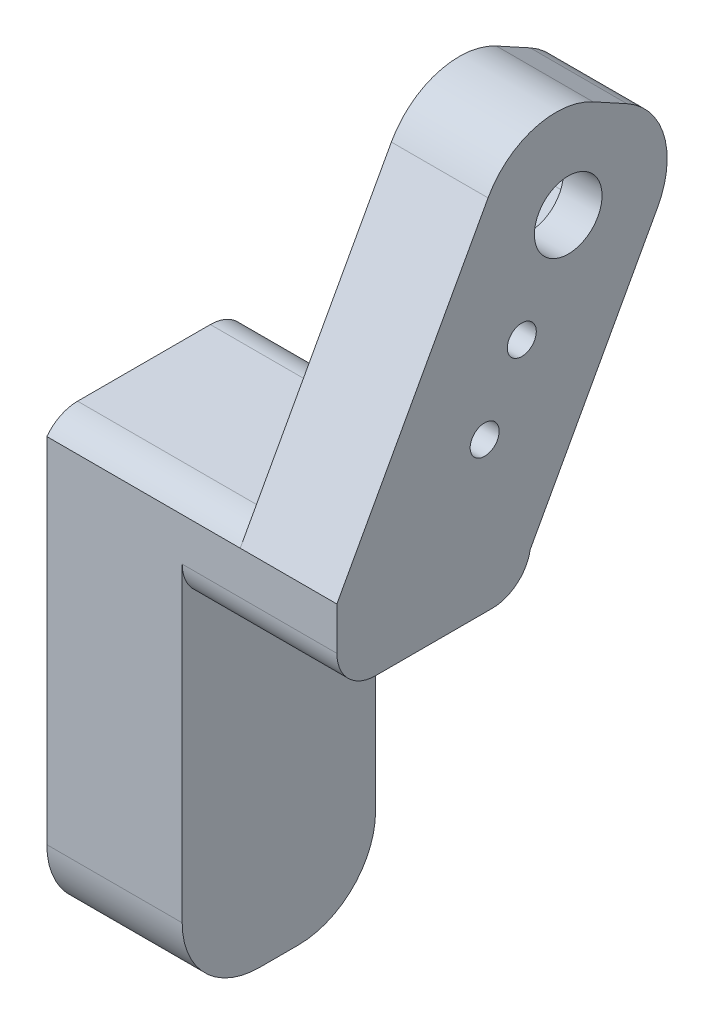
from build123d import *

# Parameters (mm, degrees)
EXTRUDE_THIN1_DEPTH = 15
SKETCH4_OUTSIDE_W   = 26.324
SKETCH4_OUTSIDE_H   = 51.391
CUT_EXTRUDE1_DEPTH  = 45.568245566
CUT_EXTRUDE2_DEPTH  = 3
SKETCH7_R           = 1.75
SKETCH7_R_2         = 0.75
CUT_EXTRUDE3_DEPTH  = 43.275324346
FILLET1_R           = 4
FILLET2_R           = 2
FILLET3_R           = 2


with BuildPart() as part:
    # Sketch3 → Extrude-Thin1 (new body)
    with BuildSketch(Plane(origin=(0, 0, 0), x_dir=(0, 0, -1), z_dir=(1, 0, 0))):
        Polygon((-4.385708038, 2.401159095), (-14.124404563, -15.386533403), (-14.124404563, -37.665690546), (-4.124404563, -37.665690546), (-4.124404563, -17.944847689), (4.385708038, -2.401159095), align=None)
    extrude(amount=EXTRUDE_THIN1_DEPTH)

    # Sketch4 outside → Cut-Extrude1 (cut, through all)
    with BuildSketch(Plane.XY.offset(14.124404563)):
        with Locations((7.5, -17.6325)):
            Rectangle(SKETCH4_OUTSIDE_W, SKETCH4_OUTSIDE_H)
        Polygon((15, 2.401159095), (10, 2.401159095), (10, -14.598840905), (0, -14.598840905), (0, -37.665690546), (7, -37.665690546), (7, -19.598840905), (15, -19.598840905), align=None, mode=Mode.SUBTRACT)
    extrude(amount=-CUT_EXTRUDE1_DEPTH, mode=Mode.SUBTRACT)

    # Sketch6 → Cut-Extrude2 (cut)
    with BuildSketch(Plane.ZY.offset(-10)):
        with BuildLine():
            Line((-0.921976714, -6.081964697), (5.150298165, -14.851265553))
            Line((5.150298165, -14.851265553), (9.736888227, -12.340124285))
            Line((9.736888227, -12.340124285), (5.620547292, -2.499956755))
            ThreePointArc((5.620547292, -2.499956755), (0.360173864, -0.657856206), (-0.921976714, -6.081964697))
        make_face()
    extrude(amount=-CUT_EXTRUDE2_DEPTH, mode=Mode.SUBTRACT)

    # Sketch7 → Cut-Extrude3 (cut, through all)
    with BuildSketch(Plane.ZY.offset(-13)):
        with Locations(Location((2.161043186, -3.947137235, 0), (0, 0, 270))):
            Circle(SKETCH7_R)
        with Locations(Location((4.562202281, -8.332845273, 0), (0, 0, 270))):
            Circle(SKETCH7_R_2)
        with Locations(Location((6.483129558, -11.841411704, 0), (0, 0, 270))):
            Circle(SKETCH7_R_2)
    extrude(amount=-CUT_EXTRUDE3_DEPTH, mode=Mode.SUBTRACT)

    # Fillet1
    fillet1_edges = [part.edges().sort_by_distance(p)[0] for p in [
        (3.5, -37.665690546, 4.124404563),
        (3.5, -37.665690546, 14.124404563),
        (12.5, 2.401159095, 4.385708038),
        (12.5, -2.401159095, -4.385708038),
    ]]
    fillet(fillet1_edges, radius=FILLET1_R)

    # Fillet2
    # the kernel refuses this fillet: 2 mm, written as the material it takes off along each edge
    with BuildSketch(Plane(origin=(7, -19.598840905, 14.124404563), x_dir=(0, 1, 0), z_dir=(1, 0, 0))) as fillet2_piece_1:
        with BuildLine():
            CenterArc((FILLET2_R, -FILLET2_R), FILLET2_R, 90, 90)
            Line((0, -FILLET2_R), (-FILLET2_R * 0.02, -FILLET2_R))
            Line((-FILLET2_R * 0.02, -FILLET2_R), (-FILLET2_R * 0.02, FILLET2_R * 0.02))
            Line((-FILLET2_R * 0.02, FILLET2_R * 0.02), (FILLET2_R, FILLET2_R * 0.02))
            Line((FILLET2_R, FILLET2_R * 0.02), (FILLET2_R, 0))
        make_face()
    extrude(amount=13, mode=Mode.SUBTRACT)
    with BuildSketch(Plane(origin=(7, -19.598840905, 4.124404563), x_dir=(0, 1, 0), z_dir=(1, 0, 0))) as fillet2_piece_2:
        with BuildLine():
            CenterArc((2, 1.969842457), FILLET2_R, 180, 80.037511241)
            Line((0, 1.969842457), (-0.04, 1.969842457))
            Line((-0.04, 1.969842457), (-0.04, 0))
            Line((-0.04, 0), (0, -0.04))
            ThreePointArc((0, -0.04), (0.826996608, -0.04), (1.64707308, -0.039396849))
            Line((1.64707308, -0.039396849), (1.653993216, 0))
        make_face()
    extrude(amount=12.924606142, mode=Mode.SUBTRACT)

    # Fillet3
    # the kernel refuses this fillet: 2 mm, written as the material it takes off along each edge
    with BuildSketch(Plane(origin=(10, -14.598840905, 2.292478098), x_dir=(0, -0.8771416076820373, 0.48023181909674706), z_dir=(-1, 0, 0))) as fillet3_piece_1:
        with BuildLine():
            CenterArc((FILLET3_R * 1.68756310969, FILLET3_R), FILLET3_R, 151.299456423, 118.700543577)
            Line((FILLET3_R * 0.810421502006, FILLET3_R * 1.4802318191), (FILLET3_R * 0.792878669852, FILLET3_R * 1.48983645548))
            Line((FILLET3_R * 0.792878669852, FILLET3_R * 1.48983645548), (-FILLET3_R * 0.0337512621938, -FILLET3_R * 0.02))
            Line((-FILLET3_R * 0.0337512621938, -FILLET3_R * 0.02), (FILLET3_R * 1.68756310969, -FILLET3_R * 0.02))
            Line((FILLET3_R * 1.68756310969, -FILLET3_R * 0.02), (FILLET3_R * 1.68756310969, 0))
        make_face()
    extrude(amount=18.437815548, mode=Mode.SUBTRACT)
    with BuildSketch(Plane(origin=(-2.898590554, -14.598840905, 13.693145803), x_dir=(0, -0.8771416076820384, 0.48023181909674506), z_dir=(1, 0, 0))) as fillet3_piece_2:
        with BuildLine():
            CenterArc((1.19748505, 1.97745339), FILLET3_R, 208.700543577, 52.688089319)
            Line((-0.556798166, 1.016989751), (-0.59188383, 0.997780479))
            Line((-0.59188383, 0.997780479), (-0.035085664, -0.019209273))
            Line((-0.035085664, -0.019209273), (0, -0.04))
            ThreePointArc((0, -0.04), (0.449011022, -0.04), (0.892032783, -0.039549068))
            Line((0.892032783, -0.039549068), (0.898022043, 0))
        make_face()
    extrude(amount=12.898590554, mode=Mode.SUBTRACT)


solid = part.part
